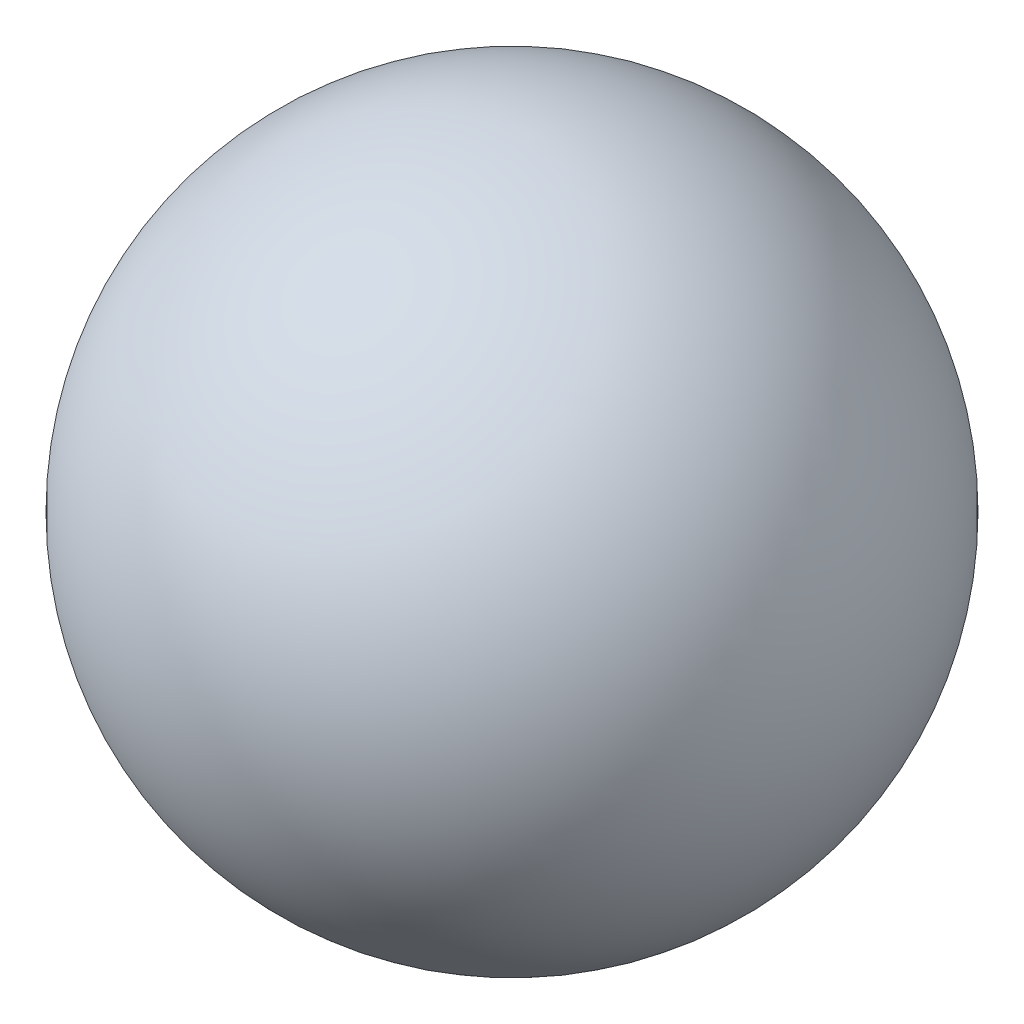
from build123d import *


with BuildPart() as part:
    # Sketch1 → Revolve1 (revolve)
    with BuildSketch(Plane(origin=(0, 0, 0), x_dir=(1, 0, 0), z_dir=(0, 1, 0))):
        with BuildLine():
            Line((0, 0), (15.086830283, 15.086830283))
            ThreePointArc((15.086830283, 15.086830283), (15.086830283, -15.086830283), (-15.086830283, -15.086830283))
            Line((-15.086830283, -15.086830283), (0, 0))
        make_face()
    revolve(axis=Axis((0, 0, 0), (0.7071067811865464, 0, -0.7071067811865488)))


solid = part.part
